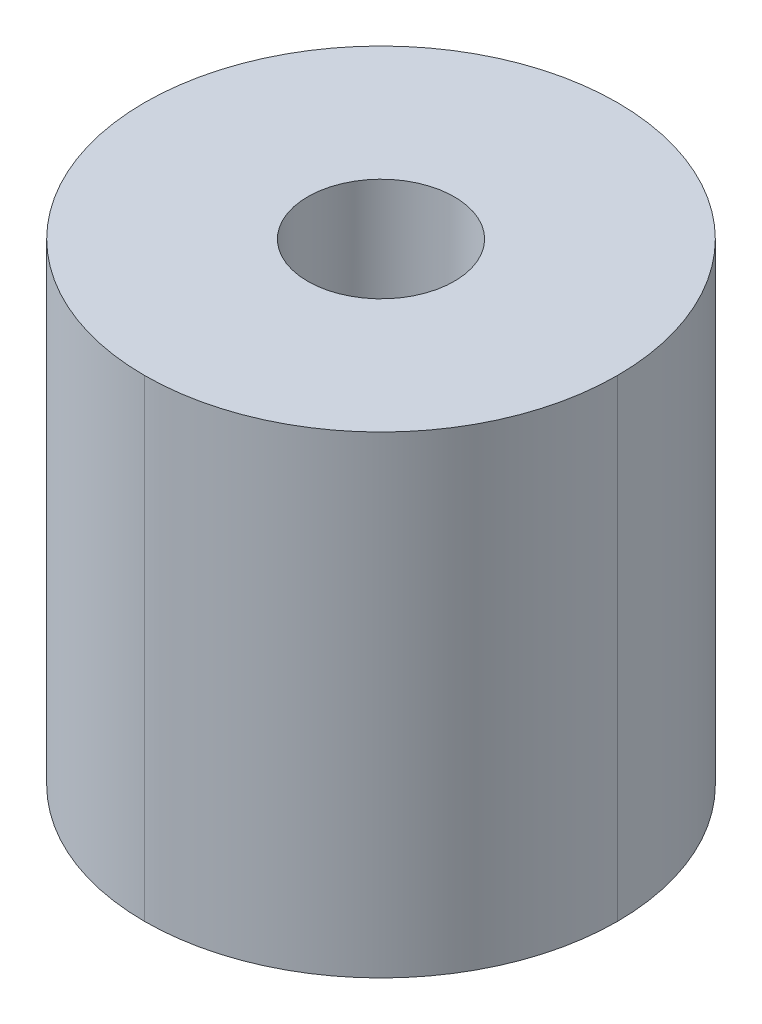
from build123d import *

# Parameters (mm, degrees)
SKETCH1_W           = 20
SKETCH1_H           = 20
BOSS_EXTRUDE1_DEPTH = 20
SKETCH2_R           = 3.1
CUT_EXTRUDE1_DEPTH  = 20
SKETCH3_R           = 5.075
CUT_EXTRUDE2_DEPTH  = 9.3
CHAMFER1_SIZE       = 3
FILLET1_R           = 10


# Some blends are built 0.0001 mm under size
with BuildPart() as part:
    # Sketch1 → Boss-Extrude1 (new body)
    with BuildSketch(Plane(origin=(0, 0, 0), x_dir=(1, 0, 0), z_dir=(0, 1, 0))):
        Rectangle(SKETCH1_W, SKETCH1_H)
    extrude(amount=BOSS_EXTRUDE1_DEPTH)

    # Sketch2 → Cut-Extrude1 (cut)
    with BuildSketch(Plane(origin=(0, 20, 0), x_dir=(1, 0, 0), z_dir=(0, 1, 0))):
        with Locations(Location((0, 0, 0), (0, 0, 270))):
            Circle(SKETCH2_R)
    extrude(amount=-CUT_EXTRUDE1_DEPTH, mode=Mode.SUBTRACT)

    # Sketch3 → Cut-Extrude2 (cut)
    with BuildSketch(Plane.XZ):
        with Locations(Location((0, 0, 0), (0, 0, 270))):
            Circle(SKETCH3_R)
    extrude(amount=-CUT_EXTRUDE2_DEPTH, mode=Mode.SUBTRACT)

    # Chamfer1
    # the kernel refuses this chamfer: 3 mm, written as the material it takes off along each edge
    with BuildSketch(Plane(origin=(0, 9.3, 0), x_dir=(0, 0, 1), z_dir=(-1, 0, 0))) as chamfer1_piece_1_section:
        Polygon((3.1, CHAMFER1_SIZE), (3.1 + CHAMFER1_SIZE, 0), (3.1, 0), align=None)
    chamfer1_piece_1 = revolve(axis=Axis((0, 9.3, 0), (0, 1, 0)), mode=Mode.PRIVATE)
    chamfer1_piece_1 = chamfer1_piece_1 & Plane(origin=(0, 11.321537765, 0), x_dir=(0, 0, -1), z_dir=(0, -1, 0)) * Cylinder(5.075, 25, mode=Mode.PRIVATE)
    add(chamfer1_piece_1, mode=Mode.SUBTRACT)

    # Fillet1
    fillet1_edges = [part.edges().sort_by_distance(p)[0] for p in [
        (10, 10, 10),
        (10, 10, -10),
        (-10, 10, -10),
        (-10, 10, 10),
    ]]
    fillet(fillet1_edges, radius=FILLET1_R - 0.0001)  # a hair under: the kernel refuses the full size


solid = part.part
